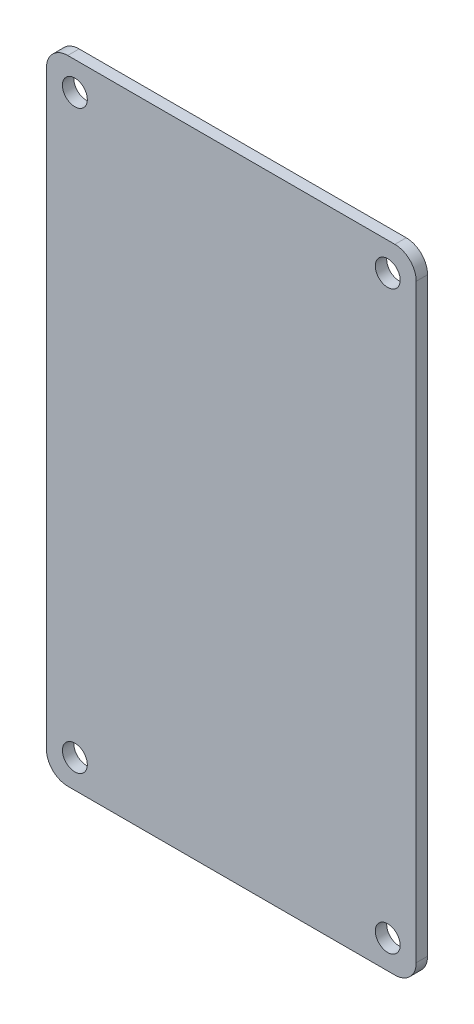
from build123d import *

# Parameters (mm, degrees)
ESQUISSE1_W                  = 52
ESQUISSE1_H                  = 89
BOSS_EXTRU_1_DEPTH           = 1.6
ENL_V_MAT_EXTRU_1_DEPTH      = 104.090057717
ENL_V_MAT_EXTRU_1_DEPTH_BACK = 104.090057717
ESQUISSE2_R                  = 1.75
CONG_1_R                     = 3


with BuildPart() as part:
    # Esquisse1 → Boss.-Extru.1 (new body)
    with BuildSketch(Plane.XY):
        with Locations((26, 44.5)):
            Rectangle(ESQUISSE1_W, ESQUISSE1_H)
    extrude(amount=BOSS_EXTRU_1_DEPTH)

    # Esquisse2 → Enlèv. mat.-Extru.1 (cut, two sides: drawn at the far end of the back side and taken through both)
    with BuildSketch(Plane.XY.offset(1.6).offset(-ENL_V_MAT_EXTRU_1_DEPTH_BACK)):
        with Locations((48, 85)):
            Circle(ESQUISSE2_R)
        with Locations((48, 4)):
            Circle(ESQUISSE2_R)
        with Locations((4, 4)):
            Circle(ESQUISSE2_R)
        with Locations((4, 85)):
            Circle(ESQUISSE2_R)
    extrude(amount=ENL_V_MAT_EXTRU_1_DEPTH + ENL_V_MAT_EXTRU_1_DEPTH_BACK, mode=Mode.SUBTRACT)

    # Congé1
    cong_1_edges = [part.edges().sort_by_distance(p)[0] for p in [
        (0, 0, 0.8),
        (52, 0, 0.8),
        (52, 89, 0.8),
        (0, 89, 0.8),
    ]]
    fillet(cong_1_edges, radius=CONG_1_R)


solid = part.part
